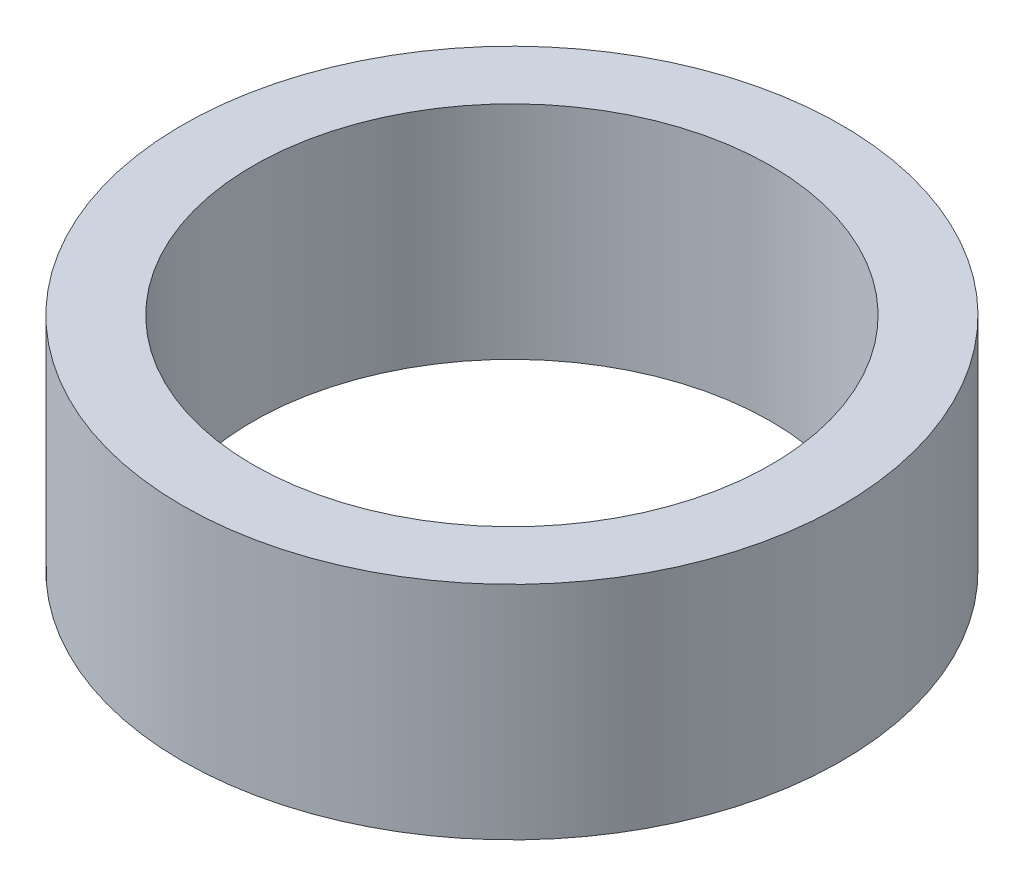
from build123d import *

# Parameters (mm, degrees)
ESQUISSE1_R        = 3.5
ESQUISSE1_R_2      = 2.75
BOSS_EXTRU_1_DEPTH = 2.35


with BuildPart() as part:
    # Esquisse1 → Boss.-Extru.1 (new body)
    with BuildSketch(Plane(origin=(0, 0, 0), x_dir=(1, 0, 0), z_dir=(0, 1, 0))):
        Circle(ESQUISSE1_R)
        Circle(ESQUISSE1_R_2, mode=Mode.SUBTRACT)
    extrude(amount=BOSS_EXTRU_1_DEPTH)


solid = part.part
